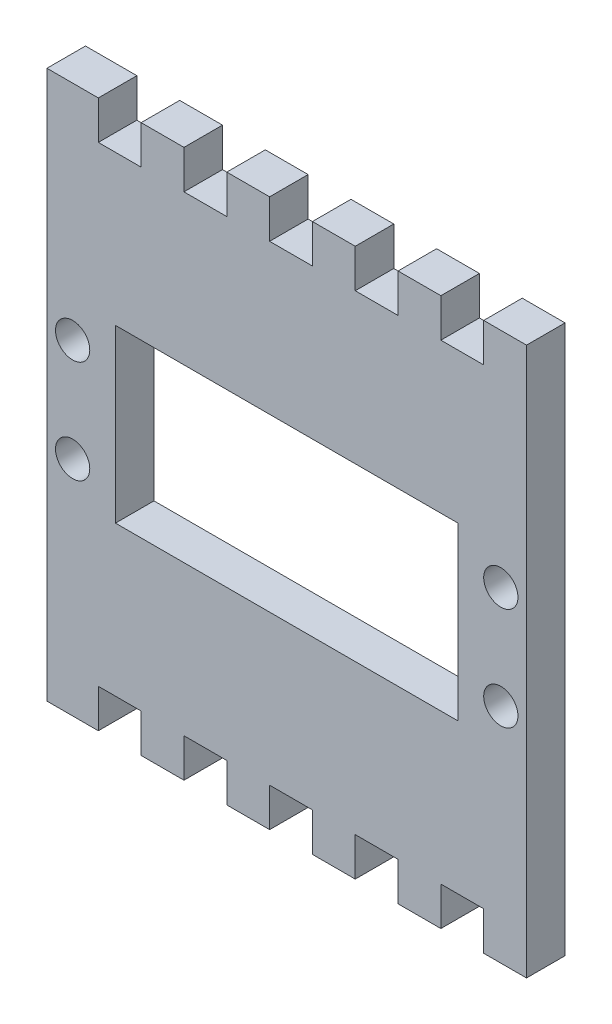
from build123d import *

# Parameters (mm, degrees)
BOSS_EXTRUDE1_DEPTH   = 64
SKETCH2_W             = 40
SKETCH2_H             = 20
CUT_EXTRUDE1_DEPTH    = 30
SKETCH3_W             = 64
SKETCH3_H             = 4.5
BOSS_EXTRUDE2_DEPTH   = 8
SKETCH4_W             = 64
SKETCH4_H             = 4.5
BOSS_EXTRUDE3_DEPTH   = 8
SKETCH5_R             = 2
CUT_EXTRUDE6_DEPTH    = 7
SKETCH6_W             = 5
SKETCH6_H             = 4.5
CUT_EXTRUDE7_DEPTH    = 7
BODY_MOVE_COPY1_ANGLE = 90
BODY_MOVE_COPY2_ANGLE = 12.4160704


with BuildPart() as part:
    # Sketch1 → Boss-Extrude1 (new body)
    with BuildSketch(Plane.XY):
        Polygon((-70.899702081, 53.100294195), (-109.964182504, 44.499923896), (-108.996640846, 40.105169848), (-69.932160423, 48.705540147), align=None)
    extrude(amount=BOSS_EXTRUDE1_DEPTH)

    # Sketch2 → Cut-Extrude1 (cut)
    with BuildSketch(Plane(origin=(-14.427653835, 65.533085344, 0), x_dir=(0.9766120105757768, 0.21500925747311134, 0), z_dir=(-0.21500925747311134, 0.9766120105757768, 0))):
        with Locations((-77.824445772, -32)):
            Rectangle(SKETCH2_W, SKETCH2_H)
    extrude(amount=-CUT_EXTRUDE1_DEPTH, mode=Mode.SUBTRACT)


with BuildPart() as cut_extrude1_piece_1:
    # of the separate pieces the step leaves, piece 1, a body of its own (cut_extrude1_pieces)
    add(part.part.solids().sort_by_distance((-70.899702081, 53.100294195, 0))[0])



with BuildPart() as cut_extrude1_piece_2:
    # of the separate pieces the step leaves, piece 2, a body of its own (cut_extrude1_pieces)
    add(part.part.solids().sort_by_distance((-70.899702081, 53.100294195, 42))[0])


with BuildPart() as cut_extrude1_piece_1_1:
    add(cut_extrude1_piece_1.part)

    add(cut_extrude1_piece_2.part)  # Boss-Extrude2 merges Cut-Extrude1 piece 2
    # Sketch3 → Boss-Extrude2 (add)
    with BuildSketch(Plane(origin=(-56.472048246, -12.432791149, 0), x_dir=(0, 0, -1), z_dir=(0.976612010575777, 0.2150092574731111, 0))):
        with Locations((-32, 64.852477375)):
            Rectangle(SKETCH3_W, SKETCH3_H)
    extrude(amount=BOSS_EXTRUDE2_DEPTH)

    # Sketch4 → Boss-Extrude3 (add)
    with BuildSketch(Plane(origin=(-95.536528669, -21.033161448, 0), x_dir=(0, 0, 1), z_dir=(-0.9766120105757774, -0.21500925747310878, 0))):
        with Locations((32, 64.852477375)):
            Rectangle(SKETCH4_W, SKETCH4_H)
    extrude(amount=BOSS_EXTRUDE3_DEPTH)

    # Sketch5 → Cut-Extrude6 (cut)
    with BuildSketch(Plane(origin=(-13.460112176, 61.138331296, 0), x_dir=(0.976612010575777, 0.21500925747311095, 0), z_dir=(0.21500925747311095, -0.976612010575777, 0))):
        with Locations((-52.824445772, 26)):
            Circle(SKETCH5_R)
        with Locations((-52.824445772, 38)):
            Circle(SKETCH5_R)
        with Locations((-102.824445772, 26)):
            Circle(SKETCH5_R)
        with Locations((-102.824445772, 38)):
            Circle(SKETCH5_R)
    extrude(amount=-CUT_EXTRUDE6_DEPTH, mode=Mode.SUBTRACT)

    # Sketch6 → Cut-Extrude7 (cut)
    with BuildSketch(Plane(origin=(-13.460112176, 61.138331296, 0), x_dir=(0.976612010575777, 0.21500925747311095, 0), z_dir=(0.21500925747311095, -0.976612010575777, 0))):
        with Locations((-57.324445772, 2.25)):
            Rectangle(SKETCH6_W, SKETCH6_H)
        with Locations((-67.324445772, 2.25)):
            Rectangle(SKETCH6_W, SKETCH6_H)
        with Locations((-77.324445772, 2.25)):
            Rectangle(SKETCH6_W, SKETCH6_H)
        with Locations((-87.324445772, 2.25)):
            Rectangle(SKETCH6_W, SKETCH6_H)
        with Locations((-97.324445772, 2.25)):
            Rectangle(SKETCH6_W, SKETCH6_H)
        with Locations((-97.324445772, 61.75)):
            Rectangle(SKETCH6_W, SKETCH6_H)
        with Locations((-87.324445772, 61.75)):
            Rectangle(SKETCH6_W, SKETCH6_H)
        with Locations((-77.324445772, 61.75)):
            Rectangle(SKETCH6_W, SKETCH6_H)
        with Locations((-67.324445772, 61.75)):
            Rectangle(SKETCH6_W, SKETCH6_H)
        with Locations((-57.324445772, 61.75)):
            Rectangle(SKETCH6_W, SKETCH6_H)
    extrude(amount=-CUT_EXTRUDE7_DEPTH, mode=Mode.SUBTRACT)


with BuildPart() as cut_extrude1_piece_1_2:
    # Body-Move/Copy1: read off the stored shape, not the designer's step
    # Body-Move/Copy1: moved
    add(cut_extrude1_piece_1_1.part.moved(Location((0, -54.8203683, 54.8203683))).rotate(Axis((0, 0, 0), (-1, 0, 0)), BODY_MOVE_COPY1_ANGLE))


with BuildPart() as cut_extrude1_piece_1_3:
    # Body-Move/Copy2: read off the stored shape, not the designer's step
    # Body-Move/Copy2: moved
    add(cut_extrude1_piece_1_2.part.moved(Location((2.9503173, 0, 14.8930484))).rotate(Axis((0, 0, 0), (0, -1, 0)), BODY_MOVE_COPY2_ANGLE))


solid = cut_extrude1_piece_1_3.part
